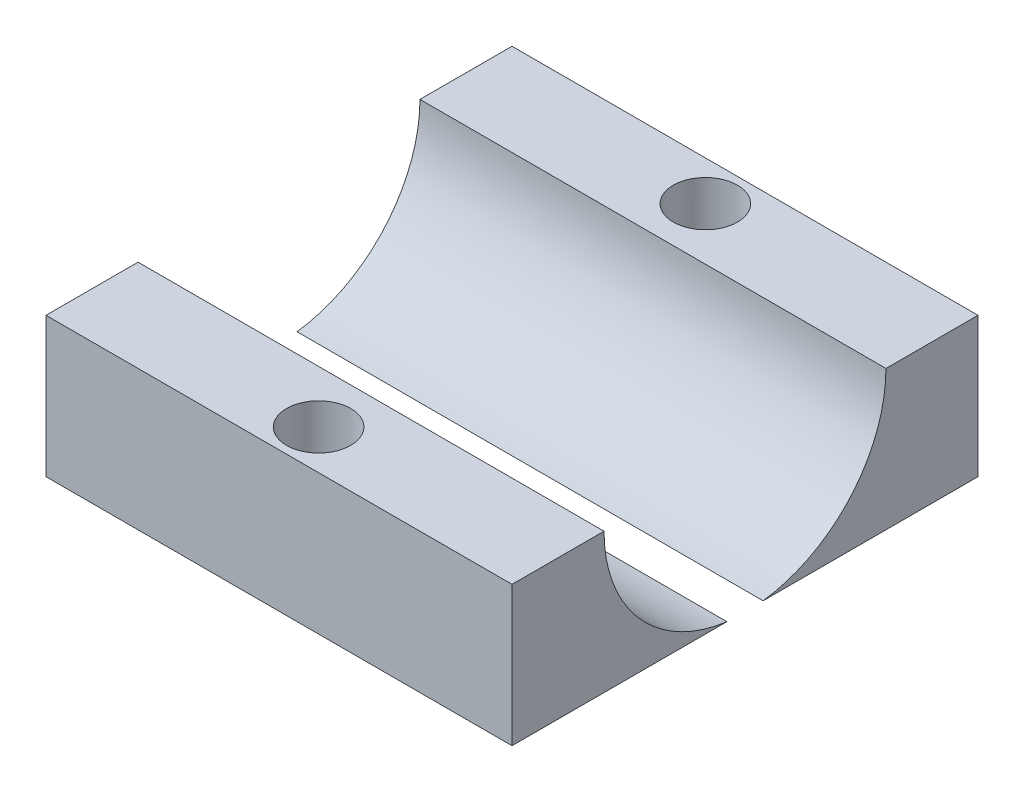
from build123d import *

# Parameters (mm, degrees)
SKETCH1_W                     = 40
SKETCH1_H                     = 12
CLAMP_LOWER_HALF_DEPTH        = 20
HANDLEBAR_BORE_DEPTH          = 38.094473982
HANDLEBAR_BORE_DEPTH_BACK     = 38.094473982
SKETCH2_R                     = 12.1
M5_CLEARANCE_HOLES_DEPTH      = 38.094473982
M5_CLEARANCE_HOLES_DEPTH_BACK = 38.094473982
SKETCH3_R                     = 2.75


with BuildPart() as part:
    # Sketch1 → Clamp Lower Half (new, symmetric)
    with BuildSketch(Plane(origin=(0, 0, 0), x_dir=(0, 0, -1), z_dir=(1, 0, 0))):
        with Locations((0, -18)):
            Rectangle(SKETCH1_W, SKETCH1_H)
    extrude(amount=CLAMP_LOWER_HALF_DEPTH, both=True)

    # Sketch2 → Handlebar Bore (cut, two sides: drawn at the far end of the back side and taken through both)
    with BuildSketch(Plane(origin=(0, 0, 0), x_dir=(0, 0, -1), z_dir=(1, 0, 0)).offset(-HANDLEBAR_BORE_DEPTH_BACK)):
        with Locations((0, -12)):
            Circle(SKETCH2_R)
    extrude(amount=HANDLEBAR_BORE_DEPTH + HANDLEBAR_BORE_DEPTH_BACK, mode=Mode.SUBTRACT)


with BuildPart() as handlebar_bore_piece_1:
    # of the separate pieces the step leaves, piece 1, a body of its own (handlebar_bore_pieces)
    add(part.part.solids().sort_by_distance((20, -24, 20))[0])


with BuildPart() as handlebar_bore_piece_2:
    # of the separate pieces the step leaves, piece 2, a body of its own (handlebar_bore_pieces)
    add(part.part.solids().sort_by_distance((20, -24, -1.55241747))[0])


with BuildPart() as m5_clearance_holes_tool:
    # Sketch3 → M5 Clearance Holes (new, two sides: drawn at the far end of the back side and taken through both)
    with BuildSketch(Plane(origin=(0, 0, 0), x_dir=(1, 0, 0), z_dir=(0, 1, 0)).offset(-M5_CLEARANCE_HOLES_DEPTH_BACK)):
        with Locations((0, -16.6)):
            Circle(SKETCH3_R)
        with Locations((0, 16.6)):
            Circle(SKETCH3_R)
    extrude(amount=M5_CLEARANCE_HOLES_DEPTH + M5_CLEARANCE_HOLES_DEPTH_BACK)


with BuildPart() as handlebar_bore_piece_1_1:
    add(handlebar_bore_piece_1.part)

    # M5 Clearance Holes: cut by m5_clearance_holes_tool
    add(m5_clearance_holes_tool.part, mode=Mode.SUBTRACT)


with BuildPart() as handlebar_bore_piece_2_1:
    add(handlebar_bore_piece_2.part)

    # M5 Clearance Holes: cut by m5_clearance_holes_tool
    add(m5_clearance_holes_tool.part, mode=Mode.SUBTRACT)


solid = Compound([handlebar_bore_piece_1_1.part, handlebar_bore_piece_2_1.part])
